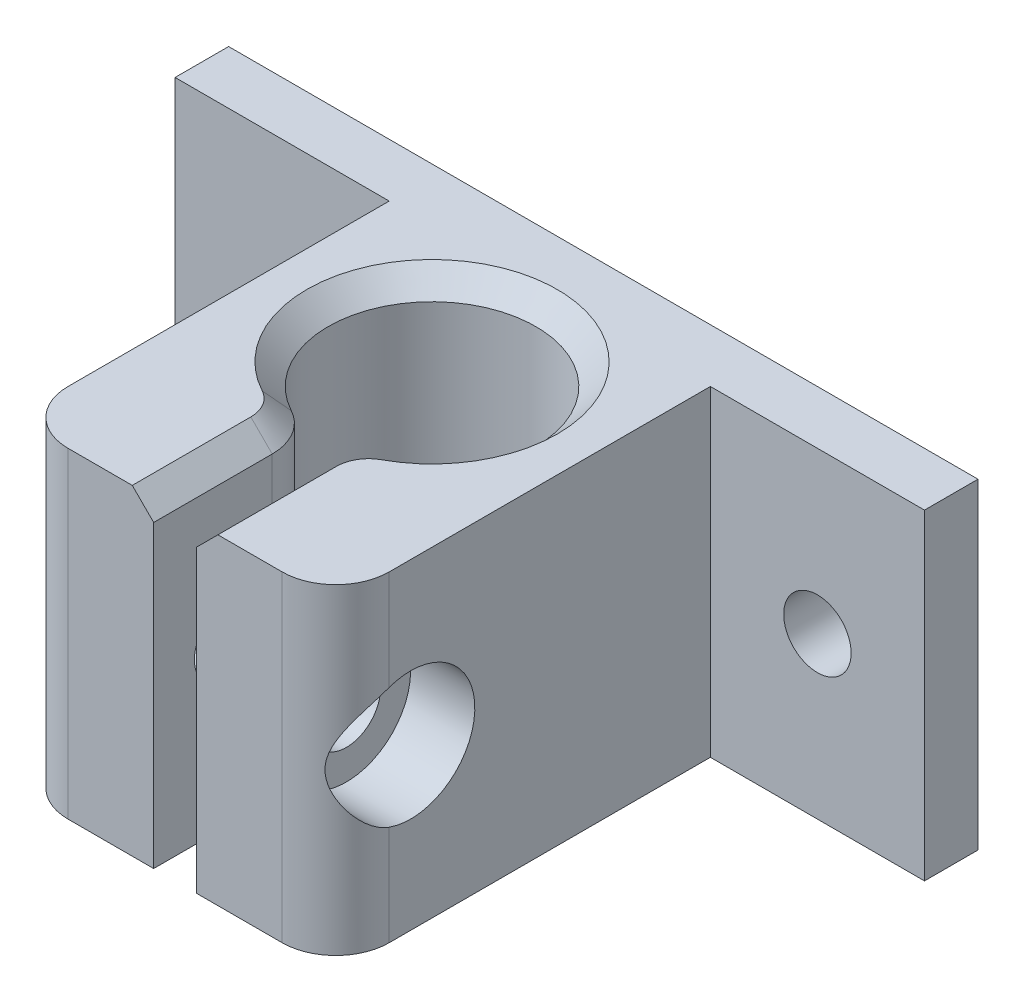
from build123d import *

# Parameters (mm, degrees)
SKETCH_1_W          = 70
SKETCH_1_H          = 30
EXTRUDE_1_DEPTH     = 5
SKETCH_2_R          = 3.15
CUT_EXTRUDE_1_DEPTH = 5
SKETCH_3_W          = 30
SKETCH_3_H          = 30
EXTRUDE_2_DEPTH     = 35
SKETCH_4_R          = 9.7
CUT_EXTRUDE_2_DEPTH = 30
CHAMFER_1_SIZE      = 5
SKETCH_5_W          = 4
SKETCH_5_H          = 18
CUT_EXTRUDE_3_DEPTH = 30
FILLET_1_R          = 5
SKETCH_6_R          = 3.2
CUT_EXTRUDE_4_DEPTH = 30
SKETCH_7_R          = 6
CUT_EXTRUDE_5_DEPTH = 6
CUT_EXTRUDE_6_DEPTH = 6
FILLET_2_R          = 5
CHAMFER_2_SIZE      = 2


with BuildPart() as part:
    # 草图1 → 凸台-拉伸1 (new body)
    with BuildSketch(Plane.XY):
        Rectangle(SKETCH_1_W, SKETCH_1_H)
    extrude(amount=EXTRUDE_1_DEPTH)

    # 草图2 → 切除-拉伸1 (cut)
    with BuildSketch(Plane.XY.offset(5)):
        with Locations((-25, 0)):
            Circle(SKETCH_2_R)
        with Locations((25, 0)):
            Circle(SKETCH_2_R)
    extrude(amount=-CUT_EXTRUDE_1_DEPTH, mode=Mode.SUBTRACT)

    # 草图3 → 凸台-拉伸2 (add)
    with BuildSketch(Plane.XY.offset(5)):
        Rectangle(SKETCH_3_W, SKETCH_3_H)
    extrude(amount=EXTRUDE_2_DEPTH)

    # 草图4 → 切除-拉伸2 (cut)
    with BuildSketch(Plane(origin=(0, 15, 0), x_dir=(1, 0, 0), z_dir=(0, 1, 0))):
        with Locations(Location((0, -16, 0), (0, 0, 270))):
            Circle(SKETCH_4_R)
    extrude(amount=-CUT_EXTRUDE_2_DEPTH, mode=Mode.SUBTRACT)

    # 倒角1
    chamfer_1_edges = [part.edges().sort_by_distance(p)[0] for p in [
        (0, -15, 6.3),
    ]]
    chamfer(chamfer_1_edges, length=CHAMFER_1_SIZE)

    # 草图5 → 切除-拉伸3 (cut)
    with BuildSketch(Plane(origin=(0, 15, 0), x_dir=(1, 0, 0), z_dir=(0, 1, 0))):
        with Locations((0, -31)):
            Rectangle(SKETCH_5_W, SKETCH_5_H)
    extrude(amount=-CUT_EXTRUDE_3_DEPTH, mode=Mode.SUBTRACT)

    # 圆角1
    fillet_1_edges = [part.edges().sort_by_distance(p)[0] for p in [
        (2, 2.5, 25.491575212),
        (-2, 2.5, 25.491575212),
    ]]
    fillet(fillet_1_edges, radius=FILLET_1_R)

    # 草图6 → 切除-拉伸4 (cut)
    with BuildSketch(Plane(origin=(15, 0, 0), x_dir=(0, 0, -1), z_dir=(1, 0, 0))):
        with Locations(Location((-33, 0, 0), (0, 0, 90))):
            Circle(SKETCH_6_R)
    extrude(amount=-CUT_EXTRUDE_4_DEPTH, mode=Mode.SUBTRACT)

    # 草图7 → 切除-拉伸5 (cut)
    with BuildSketch(Plane(origin=(15, 0, 0), x_dir=(0, 0, -1), z_dir=(1, 0, 0))):
        with Locations(Location((-33, 0, 0), (0, 0, 90))):
            Circle(SKETCH_7_R)
    extrude(amount=-CUT_EXTRUDE_5_DEPTH, mode=Mode.SUBTRACT)

    # 草图8 → 切除-拉伸6 (cut)
    with BuildSketch(Plane.ZY.offset(15)):
        Polygon((28, -2.886751346), (33, -5.773502692), (38, -2.886751346), (38, 2.886751346), (33, 5.773502692), (28, 2.886751346), align=None)
    extrude(amount=-CUT_EXTRUDE_6_DEPTH, mode=Mode.SUBTRACT)

    # 圆角2
    # the kernel refuses this fillet: 5 mm, written as the material it takes off along each edge
    with BuildSketch(Plane(origin=(-15, -27.5, 40), x_dir=(1, 0, 0), z_dir=(0, 1, 0)), Plane(origin=(15, 27.5, 40), x_dir=(-1, 0, 0), z_dir=(0, -1, 0))) as fillet_2_piece_1:
        with BuildLine():
            CenterArc((FILLET_2_R, FILLET_2_R), FILLET_2_R, 180, 90)
            Line((0, FILLET_2_R), (0, 0))
            Line((0, 0), (FILLET_2_R, 0))
        make_face()
    extrude(amount=55, mode=Mode.SUBTRACT)

    # 倒角2
    chamfer_2_edges = [part.edges().sort_by_distance(p)[0] for p in [
        (2, 15, 34.463164859),
        (0, 15, 6.3),
        (-2, 15, 34.463164859),
        (-2.704376535, 15, 26.36749814),
        (2.704376535, 15, 26.36749814),
    ]]
    chamfer(chamfer_2_edges, length=CHAMFER_2_SIZE)


solid = part.part
